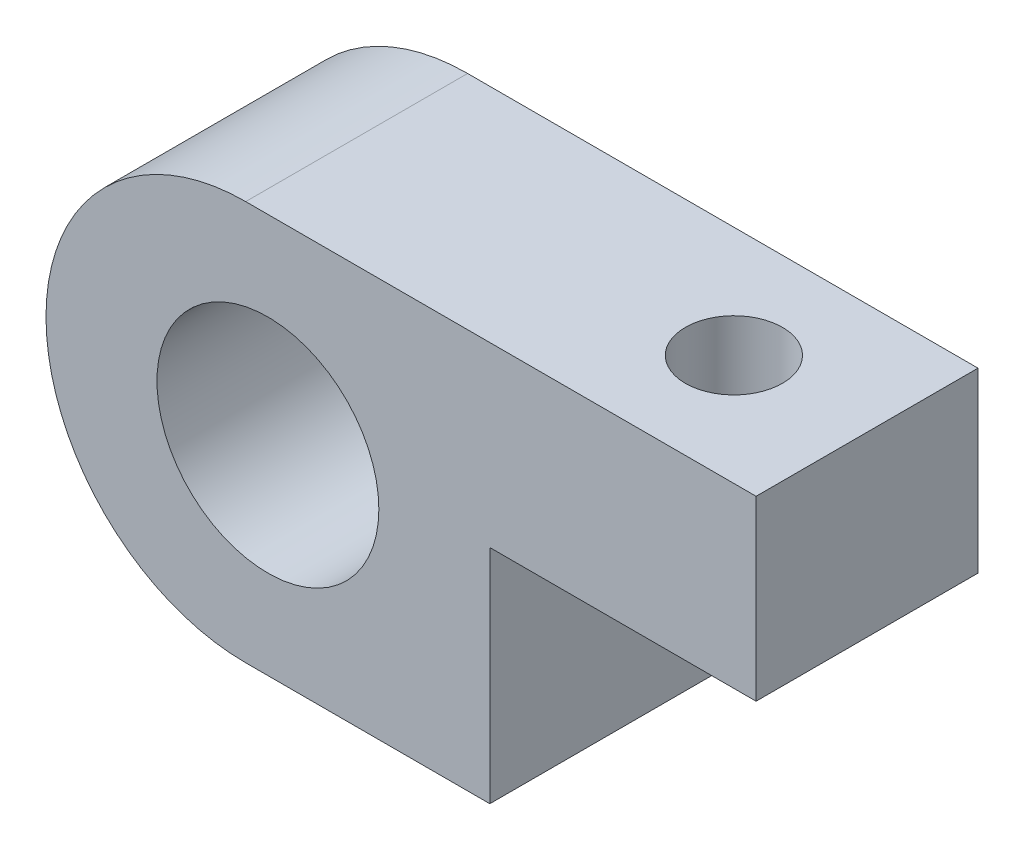
from build123d import *

# Parameters (mm, degrees)
SKETCH2_R                           = 6.35
BOSS_EXTRUDE1_DEPTH                 = 12.7
FILLET3_R                           = 11.43
F_7_32_0_21875_DIAMETER_HOLE1_D     = 5.55625
F_7_32_0_21875_DIAMETER_HOLE1_DEPTH = 36.430734093
F_7_32_0_21875_DIAMETER_HOLE1_TIP   = 1.669265907


with BuildPart() as part:
    # Sketch2 → Boss-Extrude1 (new body)
    with BuildSketch(Plane.XY):
        Polygon((0, 0), (40.64, 0), (40.64, -10.16), (25.4, -10.16), (25.4, -22.86), (0, -22.86), align=None)
        with Locations((12.7, -11.43)):
            Circle(SKETCH2_R, mode=Mode.SUBTRACT)
    extrude(amount=BOSS_EXTRUDE1_DEPTH)

    # Fillet3
    fillet3_edges = [part.edges().sort_by_distance(p)[0] for p in [
        (0, -22.86, 6.35),
        (0, 0, 6.35),
    ]]
    fillet(fillet3_edges, radius=FILLET3_R - 0.0001)  # a hair under: the kernel refuses the full size

    # 7/32 (0.21875) Diameter Hole1
    with Locations(Plane(origin=(33.02, 0, 6.35), x_dir=(0, 0, 1), z_dir=(0, 1, 0))):
        with Locations((0, 0)):
            Hole(F_7_32_0_21875_DIAMETER_HOLE1_D / 2, depth=F_7_32_0_21875_DIAMETER_HOLE1_DEPTH)
            with Locations((0, 0, -(F_7_32_0_21875_DIAMETER_HOLE1_DEPTH + F_7_32_0_21875_DIAMETER_HOLE1_TIP / 2))):  # 118° drill point
                Cone(0, F_7_32_0_21875_DIAMETER_HOLE1_D / 2, F_7_32_0_21875_DIAMETER_HOLE1_TIP, mode=Mode.SUBTRACT)


solid = part.part
